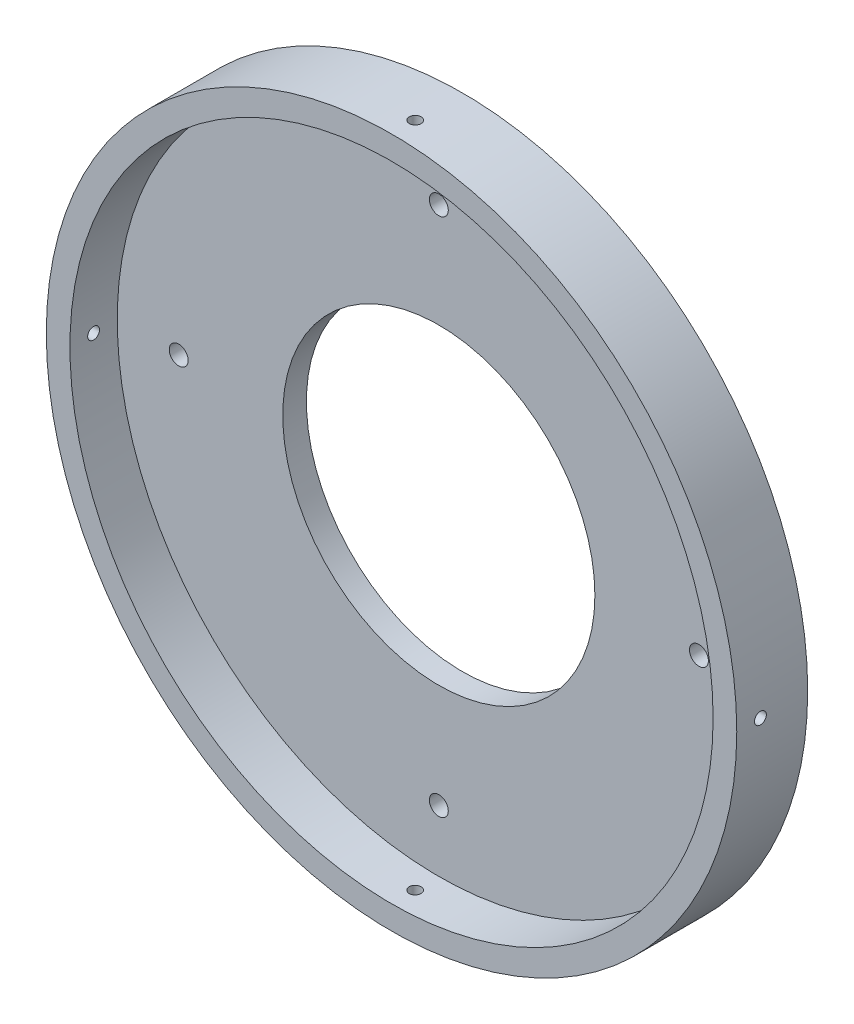
from build123d import *

# Parameters (mm, degrees)
SKETCH1_R               = 73
SKETCH1_R_2             = 33
BOSS_EXTRUDE1_DEPTH     = 5
SKETCH2_R               = 73
SKETCH2_R_2             = 68
BOSS_EXTRUDE2_DEPTH     = 10
CUT_EXTRUDE1_REACH      = 106.322
CUT_EXTRUDE1_END_RADIUS = 73
SKETCH3_R               = 1.25
CIRPATTERN1_COUNT       = 4
F_4_0MM_DOWEL_HOLE1_D   = 4


with BuildPart() as part:
    # Sketch1 → Boss-Extrude1 (new body)
    with BuildSketch(Plane.XY):
        Circle(SKETCH1_R)
        Circle(SKETCH1_R_2, mode=Mode.SUBTRACT)
    extrude(amount=BOSS_EXTRUDE1_DEPTH)

    # Sketch2 → Boss-Extrude2 (add)
    with BuildSketch(Plane.XY.offset(5)):
        Circle(SKETCH2_R)
        Circle(SKETCH2_R_2, mode=Mode.SUBTRACT)
    extrude(amount=BOSS_EXTRUDE2_DEPTH)

    # Cut-Extrude1: up to this cylinder (the profile starts inside it)
    cut_extrude1_end = Plane(origin=(0, 0, 10), z_dir=(0, 0, -1)) * Cylinder(CUT_EXTRUDE1_END_RADIUS, 359.644, mode=Mode.PRIVATE)
    # Sketch3 → Cut-Extrude1 (cut, up to the surface)
    with BuildSketch(Plane(origin=(0, 0, 0), x_dir=(1, 0, 0), z_dir=(0, 1, 0)), mode=Mode.PRIVATE) as cut_extrude1_sk1:
        with Locations((0, -10)):
            Circle(SKETCH3_R)
    cut_extrude1_tool1 = extrude(cut_extrude1_sk1.sketch, amount=-CUT_EXTRUDE1_REACH, mode=Mode.PRIVATE) & cut_extrude1_end
    cut_extrude1 = cut_extrude1_tool1.solids().sort_by_distance((0, 0, 10))[0]
    add(cut_extrude1, mode=Mode.SUBTRACT)

    # CirPattern1: Cut-Extrude1 ×4 about axis
    cirpattern1_axis = Axis((0, 0, 5), (0, 0, -1))
    for i in range(1, CIRPATTERN1_COUNT):
        add(cut_extrude1.rotate(cirpattern1_axis, i * 360 / CIRPATTERN1_COUNT), mode=Mode.SUBTRACT)

    # Ø4.0mm Dowel Hole1 (through all)
    with Locations(Plane(origin=(0, 0, 0), x_dir=(-1, 0, 0), z_dir=(0, 0, -1))):
        with Locations((0, 55), (55, 0), (0, -55), (-55, 0)):
            Hole(F_4_0MM_DOWEL_HOLE1_D / 2)


solid = part.part
